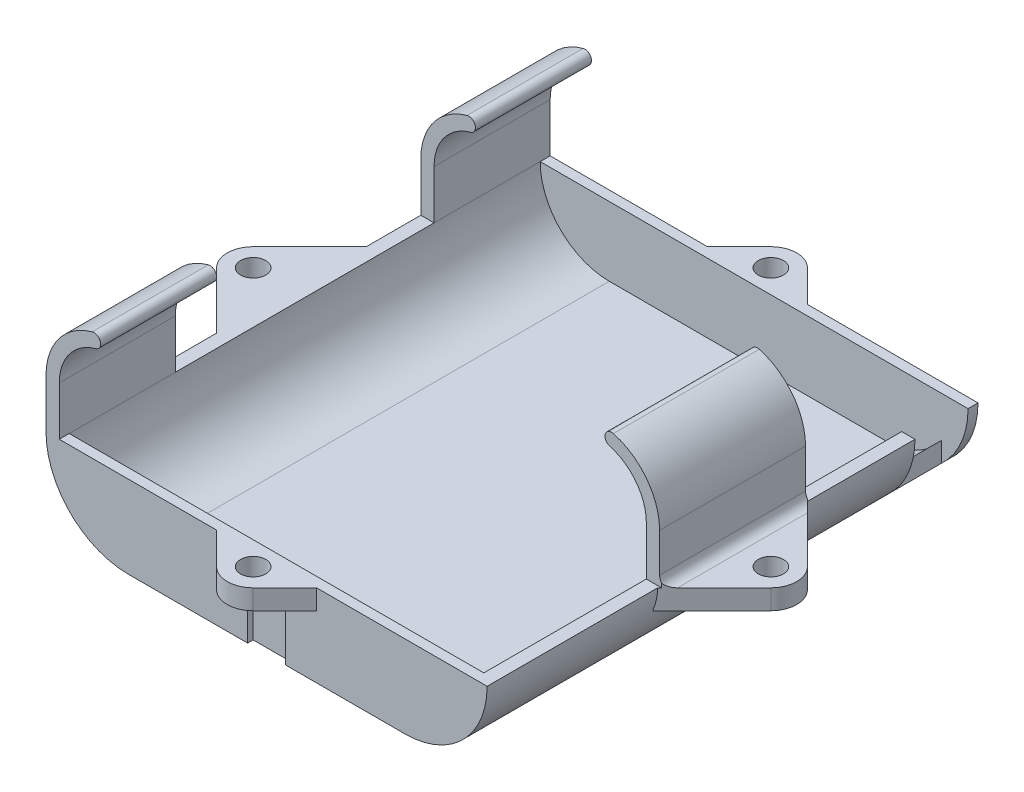
from build123d import *

# Parameters (mm, degrees)
SKETCH1_R           = 10.416666668
SKETCH1_R_2         = 10.416666667
BOSS_EXTRUDE1_DEPTH = 65
FILLET1_R           = 2
BOSS_EXTRUDE2_DEPTH = 74
BOSS_EXTRUDE3_REACH = 100.947
SKETCH3_W           = 66.5
SKETCH3_H           = 1.5
SKETCH4_R           = 1.9
BOSS_EXTRUDE4_DEPTH = 3
SKETCH5_W           = 4
SKETCH5_H           = 8
CUT_EXTRUDE1_DEPTH  = 10
BOSS_EXTRUDE5_START = -26
BOSS_EXTRUDE5_DEPTH = 22
BOSS_EXTRUDE6_DEPTH = 17.5
FILLET2_R           = 1.5
SKETCH8_W           = 5.7
SKETCH8_H           = 0.83
CUT_EXTRUDE4_DEPTH  = 9.416666667


with BuildPart() as part:
    # Sketch1 → Boss-Extrude1 (new body)
    with BuildSketch(Plane.XY):
        with Locations((10.416666667, 10.416666667)):
            Circle(SKETCH1_R)
        with BuildLine():
            ThreePointArc((20.833333333, 10.416666667), (21.626254869, 14.402952421), (23.884304362, 17.782362305))
            ThreePointArc((23.884304363, 17.782362304), (20.833333333, 16.518608725), (17.782362304, 17.782362304))
            ThreePointArc((17.782362305, 17.782362305), (20.040411798, 14.402952421), (20.833333335, 10.416666667))
        make_face()
        with BuildLine():
            ThreePointArc((17.782362304, 3.050971029), (20.833333333, 4.314724608), (23.884304363, 3.050971029))
            ThreePointArc((23.884304362, 3.050971029), (21.626254869, 6.430380913), (20.833333333, 10.416666667))
            ThreePointArc((20.833333335, 10.416666667), (20.040411798, 6.430380912), (17.782362305, 3.050971028))
        make_face()
        with Locations((31.25, 10.416666667)):
            Circle(SKETCH1_R_2)
        with BuildLine():
            ThreePointArc((44.717637696, 3.050971029), (42.459588203, 6.430380913), (41.666666666, 10.416666667))
            ThreePointArc((41.666666667, 10.416666667), (40.873745131, 6.430380913), (38.615695638, 3.050971029))
            ThreePointArc((38.615695637, 3.050971029), (41.666666667, 4.314724608), (44.717637696, 3.050971029))
        make_face()
        with BuildLine():
            ThreePointArc((38.615695638, 17.782362305), (40.873745131, 14.402952421), (41.666666667, 10.416666667))
            ThreePointArc((41.666666666, 10.416666667), (42.459588203, 14.402952421), (44.717637696, 17.782362304))
            ThreePointArc((44.717637696, 17.782362304), (41.666666667, 16.518608725), (38.615695637, 17.782362304))
        make_face()
        with Locations((52.083333333, 10.416666667)):
            Circle(SKETCH1_R_2)
    extrude(amount=BOSS_EXTRUDE1_DEPTH)

    # Fillet1
    fillet1_edges = [part.edges().sort_by_distance(p)[0] for p in [
        (31.25, -1e-09, 65),
        (31.25, 20.833333334, 0),
        (41.666666667, 16.518608725, 0),
        (62.5, 10.416666667, 0),
        (41.666666667, 4.314724608, 0),
        (31.25, -1e-09, 0),
        (20.833333333, 4.314724608, 0),
        (41.666666667, 4.314724608, 65),
        (62.5, 10.416666667, 65),
        (41.666666667, 16.518608725, 65),
        (31.25, 20.833333334, 65),
        (20.833333333, 16.518608725, 65),
        (-1e-09, 10.416666667, 65),
        (20.833333333, 4.314724608, 65),
        (-1e-09, 10.416666667, 0),
        (20.833333333, 16.518608725, 0),
    ]]
    fillet(fillet1_edges, radius=FILLET1_R)


with BuildPart() as body_2:
    # Sketch2 → Boss-Extrude2 (new body)
    with BuildSketch(Plane(origin=(0, 0, 0), x_dir=(-1, 0, 0), z_dir=(0, 0, -1))):
        with BuildLine():
            Line((-52.083333333, 0), (-10.416666667, 0))
            ThreePointArc((-10.416666667, 0), (-3.050971029, 3.050971029), (1e-09, 10.416666667))
            Line((1e-09, 10.416666667), (2.000000001, 10.416666667))
            ThreePointArc((2.000000001, 10.416666667), (-1.636757467, 1.636757467), (-10.416666667, -2))
            Line((-10.416666667, -2), (-52.083333333, -2))
            ThreePointArc((-52.083333333, -2), (-60.863242533, 1.636757467), (-64.5, 10.416666667))
            Line((-64.5, 10.416666667), (-62.5, 10.416666667))
            ThreePointArc((-62.5, 10.416666667), (-59.449028971, 3.050971029), (-52.083333333, 0))
        make_face()
    extrude(amount=-BOSS_EXTRUDE2_DEPTH)

    # Sketch3 → Boss-Extrude3 (add, up to next)
    with BuildSketch(Plane(origin=(0, 10.416666667, 0), x_dir=(1, 0, 0), z_dir=(0, 1, 0)), mode=Mode.PRIVATE) as boss_extrude3_sk1:
        with Locations((31.25, -0.75)):
            Rectangle(SKETCH3_W, SKETCH3_H)
    boss_extrude3_tool1 = extrude(boss_extrude3_sk1.sketch, amount=-BOSS_EXTRUDE3_REACH, mode=Mode.PRIVATE) - body_2.part
    # Sketch3 → Boss-Extrude3 (add, up to next)
    with BuildSketch(Plane(origin=(0, 10.416666667, 0), x_dir=(1, 0, 0), z_dir=(0, 1, 0)), mode=Mode.PRIVATE) as boss_extrude3_sk2:
        with Locations((31.25, -73.25)):
            Rectangle(SKETCH3_W, SKETCH3_H)
    boss_extrude3_tool2 = extrude(boss_extrude3_sk2.sketch, amount=-BOSS_EXTRUDE3_REACH, mode=Mode.PRIVATE) - body_2.part
    add(boss_extrude3_tool1.solids().sort_by_distance((31.25, 10.416667, 0.75))[0])
    add(boss_extrude3_tool2.solids().sort_by_distance((31.25, 10.416667, 73.25))[0])

    # Sketch4 → Boss-Extrude4 (add)
    # profile 1 of 4: a face of its own
    with BuildSketch(Plane(origin=(0, 10.416666667, 0), x_dir=(1, 0, 0), z_dir=(0, 1, 0))):
        with BuildLine():
            Line((28.492283553, 4.777716447), (22.214567107, -1.5))
            Line((22.214567107, -1.5), (40.285432893, -1.5))
            Line((40.285432893, -1.5), (34.007716446, 4.777716447))
            ThreePointArc((34.007716446, 4.777716447), (31.25, 5.92), (28.492283553, 4.777716447))
        make_face()
        with Locations(Location((31.25, 2.02, 0), (0, 0, 180))):
            Circle(SKETCH4_R, mode=Mode.SUBTRACT)
    # profile 2 of 4: a face of its own
    with BuildSketch(Plane(origin=(0, 10.416666667, 0), x_dir=(1, 0, 0), z_dir=(0, 1, 0))):
        with BuildLine():
            Line((73.027716447, -34.242283553), (62.5, -23.714567107))
            Line((62.5, -23.714567107), (62.5, -50.285432893))
            Line((62.5, -50.285432893), (73.027716447, -39.757716447))
            ThreePointArc((73.027716447, -39.757716447), (74.17, -37), (73.027716447, -34.242283553))
        make_face()
        with Locations(Location((70.27, -37, 0), (0, 0, 180))):
            Circle(SKETCH4_R, mode=Mode.SUBTRACT)
    # profile 3 of 4: a face of its own
    with BuildSketch(Plane(origin=(0, 10.416666667, 0), x_dir=(1, 0, 0), z_dir=(0, 1, 0))):
        with BuildLine():
            Line((0, -23.714567107), (0, -50.285432893))
            Line((0, -50.285432893), (-10.527716447, -39.757716447))
            ThreePointArc((-10.527716447, -39.757716447), (-11.67, -37), (-10.527716447, -34.242283553))
            Line((-10.527716447, -34.242283553), (0, -23.714567107))
        make_face()
        with Locations((-7.77, -37)):
            Circle(SKETCH4_R, mode=Mode.SUBTRACT)
    # profile 4 of 4: a face of its own
    with BuildSketch(Plane(origin=(0, 10.416666667, 0), x_dir=(1, 0, 0), z_dir=(0, 1, 0))):
        with BuildLine():
            Line((22.214567107, -72.5), (40.285432893, -72.5))
            Line((40.285432893, -72.5), (34.007716446, -78.777716447))
            ThreePointArc((34.007716446, -78.777716447), (31.25, -79.92), (28.492283553, -78.777716447))
            Line((28.492283553, -78.777716447), (22.214567107, -72.5))
        make_face()
        with Locations((31.25, -76.02)):
            Circle(SKETCH4_R, mode=Mode.SUBTRACT)
    extrude(amount=-BOSS_EXTRUDE4_DEPTH)

    # Sketch5 → Cut-Extrude1 (cut)
    with BuildSketch(Plane(origin=(0, 10.416666667, 0), x_dir=(1, 0, 0), z_dir=(0, 1, 0))):
        with Locations((62.5, -5.5)):
            Rectangle(SKETCH5_W, SKETCH5_H)
    extrude(amount=-CUT_EXTRUDE1_DEPTH, mode=Mode.SUBTRACT)

    # Sketch6 → Boss-Extrude5 (add)
    with BuildSketch(Plane.XY.offset(74).offset(BOSS_EXTRUDE5_START)):
        with BuildLine():
            Line((62.5, 10.416666667), (64.5, 10.416666667))
            Line((64.5, 10.416666667), (64.5, 12.416666667))
            Line((64.5, 12.416666667), (64.5, 17.771583853))
            ThreePointArc((64.5, 17.771583853), (62.560313045, 23.524119525), (57.533333333, 26.927577639))
            ThreePointArc((57.533333333, 26.927577639), (56.302877847, 26.230455486), (57, 25))
            ThreePointArc((57, 25), (60.968668193, 22.313059384), (62.5, 17.771583853))
            Line((62.5, 17.771583853), (62.5, 10.416666667))
        make_face()
    extrude(amount=-BOSS_EXTRUDE5_DEPTH)

    # Sketch6<3> → Boss-Extrude6 (add)
    with BuildSketch(Plane.XY.offset(74)):
        with BuildLine():
            Line((-2, 12.416666667), (-2, 10.416666667))
            Line((-2, 10.416666667), (0, 10.416666667))
            Line((0, 10.416666667), (0, 17.771583853))
            ThreePointArc((0, 17.771583853), (1.531331806, 22.313059384), (5.5, 25))
            ThreePointArc((5.5, 25), (6.197122153, 26.230455486), (4.966666666, 26.927577639))
            ThreePointArc((4.966666666, 26.927577639), (-0.060313045, 23.524119525), (-2, 17.771583853))
            Line((-2, 17.771583853), (-2, 12.416666667))
        make_face()
    boss_extrude6 = extrude(amount=-BOSS_EXTRUDE6_DEPTH)

    # Mirror1: Boss-Extrude6 across plane
    add(boss_extrude6.mirror(Plane.XY.offset(37)))

    # Fillet2
    # the kernel refuses this fillet: 1.5 mm, written as the material it adds along each edge
    with BuildSketch(Plane(origin=(64.5, 10.416666667, 48), x_dir=(1, 0, 0), z_dir=(0, 0, -1))) as fillet2_piece_1_section:
        with BuildLine():
            CenterArc((FILLET2_R, -FILLET2_R), FILLET2_R, 90, 90)
            Line((0, -FILLET2_R), (0, 0))
            Line((0, 0), (FILLET2_R, 0))
        make_face()
    fillet2_piece_1 = extrude(amount=22, mode=Mode.PRIVATE)
    fillet2_piece_1 = split(fillet2_piece_1, bisect_by=Plane(origin=(70.314772408, 10.761109215, 42.470660485), z_dir=(-0.7071067811865509, 0, -0.7071067811865442)), keep=Keep.TOP, mode=Mode.PRIVATE)
    fillet2_piece_1 = split(fillet2_piece_1, bisect_by=Plane(origin=(70.314772408, 10.761109215, 31.529339515), z_dir=(-0.7071067811865515, 0, 0.7071067811865436)), keep=Keep.TOP, mode=Mode.PRIVATE)
    add(fillet2_piece_1)

    # Sketch8 → Cut-Extrude4 (cut)
    with BuildSketch(Plane.XZ.offset(2)):
        with Locations((31.25, 0.415)):
            Rectangle(SKETCH8_W, SKETCH8_H)
        with Locations((31.25, 73.585)):
            Rectangle(SKETCH8_W, SKETCH8_H)
    extrude(amount=-CUT_EXTRUDE4_DEPTH, mode=Mode.SUBTRACT)


solid = body_2.part
